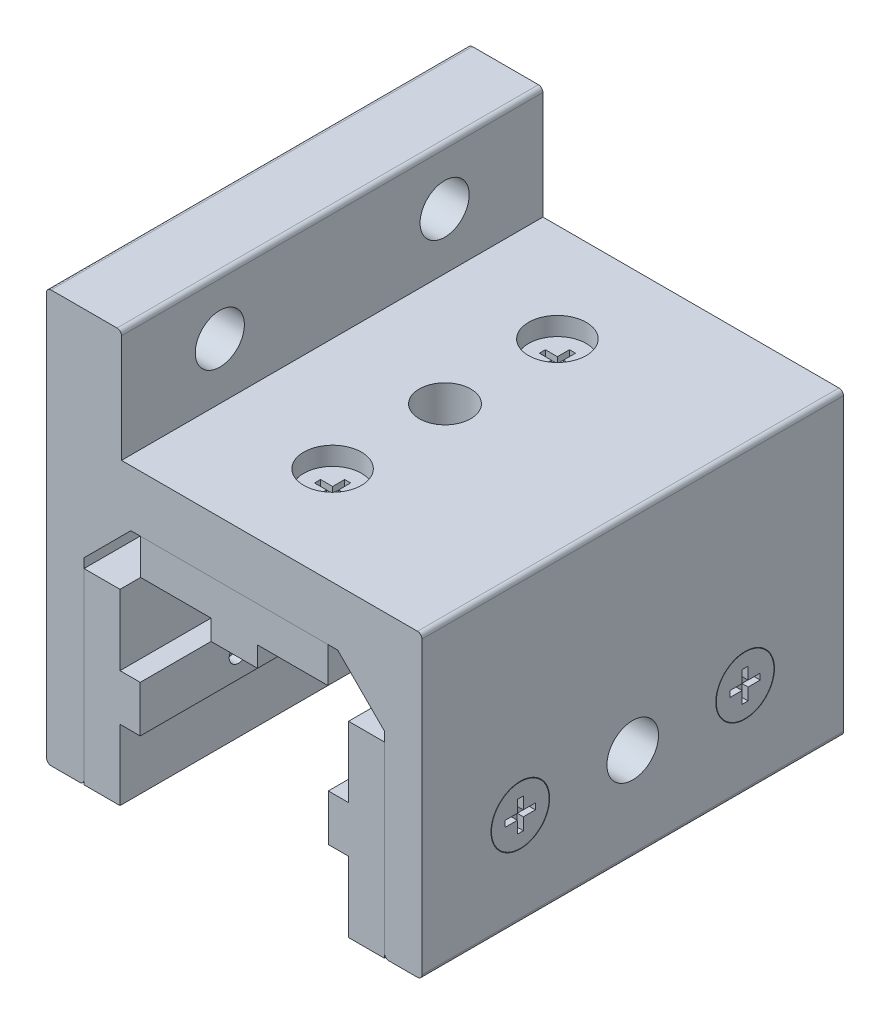
from build123d import *

# Parameters (mm, degrees)
BOSS_EXTRUDE1_DEPTH      = 35.7124
BOSS_EXTRUDE1_DEPTH_BACK = 35.7124
BOSS_EXTRUDE2_DEPTH      = 35.7124
BOSS_EXTRUDE2_DEPTH_BACK = 35.7124
CUT_EXTRUDE1_DEPTH       = 60.221870293
CUT_EXTRUDE1_DEPTH_BACK  = 60.221870293
SKETCH6_R                = 2.5527
SKETCH6_R_2              = 4.3688
SKETCH6_R_3              = 4.1656
SKETCH7_R                = 1.5875
SKETCH7_W                = 8.7376
SKETCH7_H                = 8.7376
CUT_EXTRUDE2_DEPTH       = 60.221870293
SKETCH8_R                = 2.5527
CUT_EXTRUDE3_DEPTH       = 9.525
SKETCH9_R                = 4.8895
CUT_EXTRUDE4_DEPTH       = 3.175
CHAMFER1_SIZE            = 2.4216433
CHAMFER1_SIZE_2          = 2.032
CUT_EXTRUDE5_DEPTH       = 1.039015
LPATTERN1_COUNT          = 2
LPATTERN1_PITCH          = 38.1
CIRPATTERN1_COUNT        = 3
CIRPATTERN1_ANGLE        = 180
FILLET1_R                = 0.762
SKETCH14_R               = 4.3688
CUT_EXTRUDE6_DEPTH       = 70.771873244


with BuildPart() as part:
    # Sketch4 → Boss-Extrude1 (new, two sides: drawn at the far end of the back side and taken through both)
    with BuildSketch(Plane.XY.offset(-BOSS_EXTRUDE1_DEPTH_BACK)):
        Polygon((-31.8135, -34.925), (-25.4635, -34.925), (-25.4635, -1.5875), (-17.526, 6.35), (17.526, 6.35), (25.4635, -1.5875), (25.4635, -34.925), (31.8135, -34.925), (31.8135, 15.875), (-19.1135, 15.875), (-19.1135, 34.925), (-31.8135, 34.925), align=None)
    extrude(amount=BOSS_EXTRUDE1_DEPTH + BOSS_EXTRUDE1_DEPTH_BACK)

    # Sketch6 → Cut-Extrude1 (cut, two sides: drawn at the far end of the back side and taken through both)
    with BuildSketch(Plane(origin=(0, 0, 0), x_dir=(0, 0, -1), z_dir=(1, 0, 0)).offset(-CUT_EXTRUDE1_DEPTH_BACK)):
        with Locations((-19.05, -19.05)):
            Circle(SKETCH6_R)
        with Locations((0, -19.05)):
            Circle(SKETCH6_R_2)
        with Locations((19.05, -19.05)):
            Circle(SKETCH6_R)
        with Locations((19.05, 25.4)):
            Circle(SKETCH6_R_3)
        with Locations((-19.05, 25.4)):
            Circle(SKETCH6_R_3)
    extrude(amount=CUT_EXTRUDE1_DEPTH + CUT_EXTRUDE1_DEPTH_BACK, mode=Mode.SUBTRACT)

    # Sketch8 → Cut-Extrude3 (cut)
    with BuildSketch(Plane(origin=(0, 15.875, 0), x_dir=(1, 0, 0), z_dir=(0, 1, 0))):
        with Locations(Location((0, 19.05, 0), (0, 0, 180))):
            Circle(SKETCH8_R)
        with Locations(Location((0, -19.05, 0), (0, 0, 180))):
            Circle(SKETCH8_R)
    extrude(amount=-CUT_EXTRUDE3_DEPTH, mode=Mode.SUBTRACT)

    # Sketch9 → Cut-Extrude4 (cut)
    with BuildSketch(Plane(origin=(0, 15.875, 0), x_dir=(1, 0, 0), z_dir=(0, 1, 0))):
        with Locations(Location((0, 19.05, 0), (0, 0, 180))):
            Circle(SKETCH9_R)
        with Locations(Location((0, -19.05, 0), (0, 0, 180))):
            Circle(SKETCH9_R)
    extrude(amount=-CUT_EXTRUDE4_DEPTH, mode=Mode.SUBTRACT)

    # Chamfer1
    # the kernel refuses this chamfer: 2.4216433, 2.032 mm, written as the material it takes off along each edge
    with BuildSketch(Plane(origin=(-31.8135, -19.05, -19.05), x_dir=(0, 0, -1), z_dir=(0, -1, 0))) as chamfer1_piece_1:
        Polygon((2.5527 + CHAMFER1_SIZE, 0), (2.5527, CHAMFER1_SIZE_2), (2.5527, 0), align=None)
    revolve(axis=Axis((-31.8135, -19.05, -19.05), (1, 0, 0)), mode=Mode.SUBTRACT)
    with BuildSketch(Plane(origin=(-31.8135, -19.05, 19.05), x_dir=(0, 0, -1), z_dir=(0, -1, 0))) as chamfer1_piece_2:
        Polygon((2.5527 + CHAMFER1_SIZE, 0), (2.5527, CHAMFER1_SIZE_2), (2.5527, 0), align=None)
    revolve(axis=Axis((-31.8135, -19.05, 19.05), (1, 0, 0)), mode=Mode.SUBTRACT)
    with BuildSketch(Plane(origin=(31.8135, -19.05, -19.05), x_dir=(0, 0, -1), z_dir=(0, 1, 0))) as chamfer1_piece_3:
        Polygon((2.5527 + CHAMFER1_SIZE, 0), (2.5527, CHAMFER1_SIZE_2), (2.5527, 0), align=None)
    revolve(axis=Axis((31.8135, -19.05, -19.05), (-1, 0, 0)), mode=Mode.SUBTRACT)
    with BuildSketch(Plane(origin=(31.8135, -19.05, 19.05), x_dir=(0, 0, -1), z_dir=(0, 1, 0))) as chamfer1_piece_4:
        Polygon((2.5527 + CHAMFER1_SIZE, 0), (2.5527, CHAMFER1_SIZE_2), (2.5527, 0), align=None)
    revolve(axis=Axis((31.8135, -19.05, 19.05), (-1, 0, 0)), mode=Mode.SUBTRACT)
    with BuildSketch(Plane(origin=(0, 12.7, 19.05), x_dir=(-1, 0, 0), z_dir=(0, 0, -1))) as chamfer1_piece_5_section:
        Polygon((2.5527, -CHAMFER1_SIZE_2), (2.5527 + CHAMFER1_SIZE, 0), (2.5527, 0), align=None)
    chamfer1_piece_5 = revolve(axis=Axis((0, 12.7, 19.05), (0, 1, 0)), mode=Mode.PRIVATE)
    chamfer1_piece_5 = chamfer1_piece_5 & Plane(origin=(0, 11.646758484, 19.05), x_dir=(-1, 0, 0), z_dir=(0, 1, 0)) * Cylinder(4.8895, 20, mode=Mode.PRIVATE)
    add(chamfer1_piece_5, mode=Mode.SUBTRACT)
    with BuildSketch(Plane(origin=(0, 12.7, -19.05), x_dir=(-1, 0, 0), z_dir=(0, 0, -1))) as chamfer1_piece_6_section:
        Polygon((2.5527, -CHAMFER1_SIZE_2), (2.5527 + CHAMFER1_SIZE, 0), (2.5527, 0), align=None)
    chamfer1_piece_6 = revolve(axis=Axis((0, 12.7, -19.05), (0, 1, 0)), mode=Mode.PRIVATE)
    chamfer1_piece_6 = chamfer1_piece_6 & Plane(origin=(0, 11.646758484, -19.05), x_dir=(-1, 0, 0), z_dir=(0, 1, 0)) * Cylinder(4.8895, 20, mode=Mode.PRIVATE)
    add(chamfer1_piece_6, mode=Mode.SUBTRACT)

    # Fillet1
    fillet1_edges = [part.edges().sort_by_distance(p)[0] for p in [
        (-31.8135, 34.925, 0),
        (-19.1135, 34.925, 0),
        (31.8135, 15.875, 0),
        (31.8135, -34.925, 0),
        (25.4635, -34.925, 0),
        (-25.4635, -34.925, 0),
        (-31.8135, -34.925, 0),
    ]]
    fillet(fillet1_edges, radius=FILLET1_R)

    # Sketch14 → Cut-Extrude6 (cut, through all)
    with BuildSketch(Plane(origin=(0, 15.875, 0), x_dir=(1, 0, 0), z_dir=(0, 1, 0))):
        with Locations(Location((0, 0, 0), (0, 0, 180))):
            Circle(SKETCH14_R)
    extrude(amount=-CUT_EXTRUDE6_DEPTH, mode=Mode.SUBTRACT)


with BuildPart() as body_2:
    # Sketch5 → Boss-Extrude2 (new, two sides: drawn at the far end of the back side and taken through both)
    with BuildSketch(Plane.XY.offset(-BOSS_EXTRUDE2_DEPTH_BACK)):
        Polygon((-25.4635, -3.175), (-25.4635, -34.925), (-19.3675, -34.925), (-19.3675, -22.987), (-15.9385, -22.987), (-15.9385, -15.113), (-19.3675, -15.113), (-19.3675, -3.175), align=None)
    extrude(amount=BOSS_EXTRUDE2_DEPTH + BOSS_EXTRUDE2_DEPTH_BACK)

    # Sketch7 → Cut-Extrude2 (cut, through all)
    with BuildSketch(Plane(origin=(0, 0, 0), x_dir=(0, 0, -1), z_dir=(1, 0, 0))):
        with Locations((-19.05, -19.05)):
            Circle(SKETCH7_R)
        with Locations((19.05, -19.05)):
            Circle(SKETCH7_R)
        with Locations((0, -19.05)):
            Rectangle(SKETCH7_W, SKETCH7_H)
    extrude(amount=-CUT_EXTRUDE2_DEPTH, mode=Mode.SUBTRACT)


with BuildPart() as body_3:
    # Sketch12 → Revolve1 (revolve)
    with BuildSketch(Plane.XY.offset(19.05), mode=Mode.PRIVATE) as revolve1_sk:
        Polygon((-31.8135, -14.1605), (-31.8135, -19.05), (-17.653, -19.05), (-17.653, -16.637), (-29.735469763, -16.637), align=None)
    revolve(revolve1_sk.sketch.rotate(Axis((-31.8135, -19.05, 19.05), (1, 0, 0)), 90), axis=Axis((-31.8135, -19.05, 19.05), (1, 0, 0)))

    # Sketch13 → Cut-Extrude5 (cut)
    with BuildSketch(Plane.ZY.offset(31.8135)):
        Polygon((19.56054, -21.6027), (18.53946, -21.6027), (18.53946, -19.56054), (16.4973, -19.56054), (16.4973, -18.53946), (18.53946, -18.53946), (18.53946, -16.4973), (19.56054, -16.4973), (19.56054, -18.53946), (21.6027, -18.53946), (21.6027, -19.56054), (19.56054, -19.56054), align=None)
    extrude(amount=-CUT_EXTRUDE5_DEPTH, mode=Mode.SUBTRACT)


with BuildPart() as lpattern1_1:
    # LPattern1: pattern copy
    add(body_3.part.moved(Location(Vector(0, 0, -1) * (1 * LPATTERN1_PITCH))))


with BuildPart() as cirpattern1_1:
    # CirPattern1: pattern copy
    add(body_2.part.rotate(Axis((0, -19.05, 0), (0, 0, -1)), 1 * CIRPATTERN1_ANGLE / (CIRPATTERN1_COUNT - 1)))


with BuildPart() as cirpattern1_2:
    # CirPattern1: pattern copy
    add(body_2.part.rotate(Axis((0, -19.05, 0), (0, 0, -1)), 2 * CIRPATTERN1_ANGLE / (CIRPATTERN1_COUNT - 1)))


with BuildPart() as cirpattern1_3:
    # CirPattern1: pattern copy
    add(body_3.part.rotate(Axis((0, -19.05, 0), (0, 0, -1)), 1 * CIRPATTERN1_ANGLE / (CIRPATTERN1_COUNT - 1)))


with BuildPart() as cirpattern1_4:
    # CirPattern1: pattern copy
    add(body_3.part.rotate(Axis((0, -19.05, 0), (0, 0, -1)), 2 * CIRPATTERN1_ANGLE / (CIRPATTERN1_COUNT - 1)))


with BuildPart() as cirpattern1_5:
    # CirPattern1: pattern copy
    add(lpattern1_1.part.rotate(Axis((0, -19.05, 0), (0, 0, -1)), 1 * CIRPATTERN1_ANGLE / (CIRPATTERN1_COUNT - 1)))


with BuildPart() as cirpattern1_6:
    # CirPattern1: pattern copy
    add(lpattern1_1.part.rotate(Axis((0, -19.05, 0), (0, 0, -1)), 2 * CIRPATTERN1_ANGLE / (CIRPATTERN1_COUNT - 1)))


solid = Compound([part.part, body_2.part, body_3.part, lpattern1_1.part, cirpattern1_1.part, cirpattern1_2.part, cirpattern1_3.part, cirpattern1_4.part, cirpattern1_5.part, cirpattern1_6.part])
